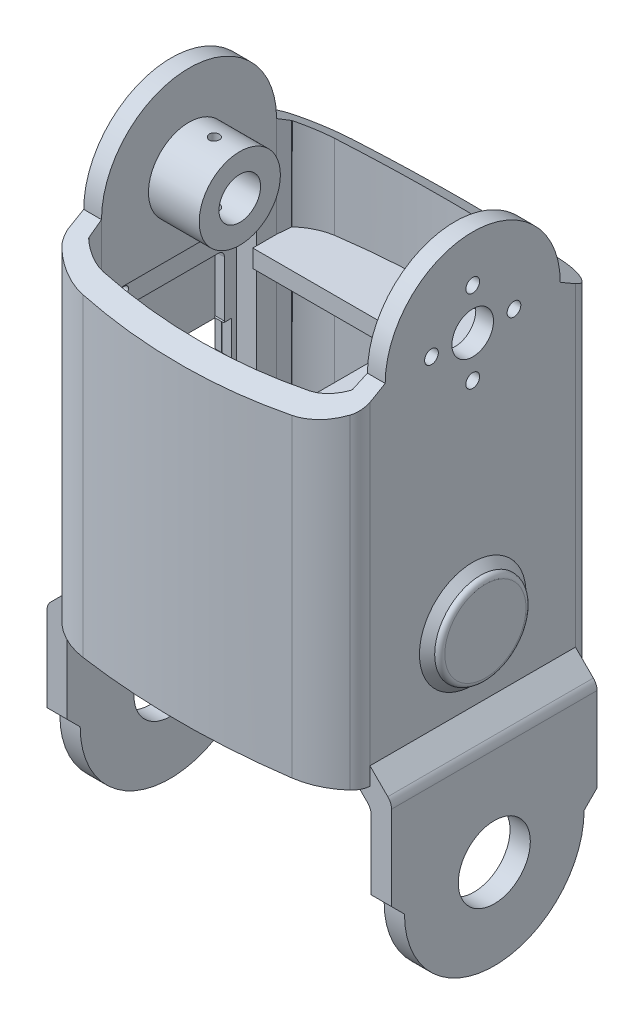
from build123d import *
from build123d.topology import SkipClean

# Parameters (mm, degrees)
SKETCH1_R                = 4.1
SKETCH1_R_2              = 1.35
BOSS_EXTRUDE1_DEPTH      = 3.5
BOSS_EXTRUDE2_DEPTH      = 67.25
CUT_EXTRUDE1_DEPTH       = 94.994268442
SKETCH4_W                = 26.5
SKETCH4_H                = 47.25
CUT_EXTRUDE2_DEPTH       = 3.5
SKETCH6_W                = 31.5
SKETCH6_H                = 52.25
BOSS_EXTRUDE3_DEPTH      = 2
CHAMFER2_SIZE            = 2
SKETCH7_W                = 26.5
SKETCH7_H                = 47.25
CUT_EXTRUDE3_DEPTH       = 0.8
CUT_EXTRUDE4_REACH       = 97.271
SKETCH8_W                = 21.401119101
SKETCH8_H                = 6.5
CUT_EXTRUDE5_REACH       = 97.271
SKETCH9_R                = 7.1
BOSS_EXTRUDE4_DEPTH      = 3.5
SKETCH11_W               = 4
SKETCH11_H               = 49.717369648
BOSS_EXTRUDE5_DEPTH      = 40
SKETCH12_R               = 7.1
CUT_EXTRUDE6_DEPTH       = 10
CHAMFER3_SIZE            = 1
CHAMFER4_SIZE            = 1
FILLET1_R                = 3
SKETCH13_R               = 9
SKETCH13_R_2             = 5.5
BOSS_EXTRUDE6_DEPTH      = 1.5
SKETCH16_R               = 9
BOSS_EXTRUDE7_DEPTH      = 1
FILLET2_R                = 1
SKETCH18_R               = 9
SKETCH18_R_2             = 7.1
BOSS_EXTRUDE8_DEPTH      = 0.5
CHAMFER5_SIZE            = 0.5
BOSS_EXTRUDE9_DEPTH      = 40.5
CUT_EXTRUDE8_REACH       = 129.458
CHAMFER6_SIZE            = 1.5
CUT_EXTRUDE9_REACH       = 129.458
SKETCH20_R               = 7.1
SKETCH21_R               = 1.5
BOSS_EXTRUDE10_DEPTH     = 3.5
CUT_EXTRUDE10_REACH      = 129.458
SKETCH22_R               = 3.75
BOSS_EXTRUDE11_DEPTH     = 1.82
BOSS_EXTRUDE12_START     = 2.65
SKETCH24_W               = 5
SKETCH24_H               = 15.934069979
SKETCH24_R               = 0.8
BOSS_EXTRUDE12_DEPTH     = 2.65
CUT_EXTRUDE11_REACH      = 118.561
SKETCH25_R               = 0.8
SKETCH26_R               = 13.375
CUT_EXTRUDE12_DEPTH      = 3.3
SKETCH27_R               = 5
BOSS_EXTRUDE13_DEPTH     = 1
FILLET7_R                = 0.75
SKETCH28_R               = 8
SKETCH28_R_2             = 4.1
BOSS_EXTRUDE14_DEPTH     = 1.5
SKETCH29_R               = 8
SKETCH29_R_2             = 4.1
BOSS_EXTRUDE15_DEPTH     = 8.5
CUT_EXTRUDE13_DEPTH      = 15
CUT_EXTRUDE13_DEPTH_BACK = 127.447026853
SKETCH30_R               = 1
SKETCH31_R               = 7.1
BOSS_EXTRUDE16_DEPTH     = 0.5
CHAMFER7_SIZE            = 0.5
CHAMFER7_OF_MIRROR5_SIZE = 0.5
FILLET8_R                = 2.5


# Some blends are built 0.0001 mm under size
with BuildPart() as part:
    # Sketch1 → Boss-Extrude1 (new body)
    with BuildSketch(Plane(origin=(0, 0, 0), x_dir=(0, 0, -1), z_dir=(1, 0, 0))):
        with BuildLine():
            Line((-17.25, 0), (-17.25, -67.25))
            Line((-17.25, -67.25), (17.25, -67.25))
            Line((17.25, -67.25), (17.25, 0))
            ThreePointArc((17.25, 0), (0, 17.25), (-17.25, 0))
        make_face()
        Circle(SKETCH1_R, mode=Mode.SUBTRACT)
        with Locations((0, 8.125)):
            Circle(SKETCH1_R_2, mode=Mode.SUBTRACT)
        with Locations((8.125, 0)):
            Circle(SKETCH1_R_2, mode=Mode.SUBTRACT)
        with Locations((-8.125, 0)):
            Circle(SKETCH1_R_2, mode=Mode.SUBTRACT)
        with Locations((0, -8.125)):
            Circle(SKETCH1_R_2, mode=Mode.SUBTRACT)
    boss_extrude1 = extrude(amount=BOSS_EXTRUDE1_DEPTH)

    # Sketch2 → Boss-Extrude2 (add)
    with BuildSketch(Plane(origin=(0, 0, 0), x_dir=(-1, 0, 0), z_dir=(0, -1, 0))):
        with BuildLine():
            Line((-59.4, -17.25), (-59.4, -20.25))
            ThreePointArc((-59.4, -20.25), (-58.989582055, -21.693064324), (-58.079872716, -22.886088403))
            ThreePointArc((-58.079872716, -22.886088403), (-54.454905265, -25.285822393), (-50.289145158, -26.529025904))
            ThreePointArc((-50.289145158, -26.529025904), (-40.020812264, -27.631788405), (-29.7, -28))
            ThreePointArc((-29.7, -28), (-19.379187736, -27.631788405), (-9.110854842, -26.529025904))
            ThreePointArc((-9.110854842, -26.529025904), (-4.945094735, -25.285822393), (-1.320127284, -22.886088403))
            ThreePointArc((-1.320127284, -22.886088403), (-0.410417945, -21.693064324), (0, -20.25))
            Line((0, -20.25), (0, -17.25))
            Line((0, -17.25), (-3.5, -17.25))
            Line((-3.5, -17.25), (-3.735903774, -19.954735321))
            ThreePointArc((-3.735903774, -19.954735321), (-3.770225997, -20.037754997), (-3.828562802, -20.106071165))
            ThreePointArc((-3.828562802, -20.106071165), (-6.407189742, -21.835001354), (-9.364778442, -22.779027613))
            ThreePointArc((-9.364778442, -22.779027613), (-19.505740765, -23.883479028), (-29.7, -24.2522722))
            ThreePointArc((-29.7, -24.2522722), (-39.894259235, -23.883479028), (-50.035221558, -22.779027613))
            ThreePointArc((-50.035221558, -22.779027613), (-52.992810258, -21.835001354), (-55.571437198, -20.106071165))
            ThreePointArc((-55.571437198, -20.106071165), (-55.629774003, -20.037754997), (-55.664096226, -19.954735321))
            Line((-55.664096226, -19.954735321), (-55.9, -17.25))
            Line((-55.9, -17.25), (-59.4, -17.25))
        make_face()
    boss_extrude2 = extrude(amount=BOSS_EXTRUDE2_DEPTH)

    # Mirror2: Boss-Extrude1 across plane
    add(boss_extrude1.mirror(Plane.ZY.offset(-29.7)))

    # Sketch3 → Cut-Extrude1 (cut, through all)
    with BuildSketch(Plane.ZY):
        Polygon((17.25, 0), (32.748612496, -8.948128097), (32.748612496, 0), align=None)
    cut_extrude1 = extrude(amount=-CUT_EXTRUDE1_DEPTH, mode=Mode.SUBTRACT)

    # Mirror3: Boss-Extrude2, Cut-Extrude1 across plane
    add(boss_extrude2.mirror(Plane(origin=(0, 0, 0), x_dir=(1, 0, 0), z_dir=(0, 0, -1))))
    add(cut_extrude1.mirror(Plane(origin=(0, 0, 0), x_dir=(1, 0, 0), z_dir=(0, 0, -1))), mode=Mode.SUBTRACT)

    # Sketch4 → Cut-Extrude2 (cut)
    with BuildSketch(Plane.ZY):
        with Locations((0, -37.125)):
            Rectangle(SKETCH4_W, SKETCH4_H)
    extrude(amount=-CUT_EXTRUDE2_DEPTH, mode=Mode.SUBTRACT)

    # Sketch6 → Boss-Extrude3 (add)
    with BuildSketch(Plane.ZY):
        with Locations((0, -37.125)):
            Rectangle(SKETCH6_W, SKETCH6_H)
    extrude(amount=BOSS_EXTRUDE3_DEPTH)

    # Chamfer2
    chamfer2_edges = [part.edges().sort_by_distance(p)[0] for p in [
        (-2, -63.25, 0),
        (-2, -37.125, 15.75),
        (-2, -37.125, -15.75),
        (-2, -11, 0),
    ]]
    chamfer(chamfer2_edges, length=CHAMFER2_SIZE - 0.0001)  # a hair under: the kernel refuses the full size

    # Sketch7 → Cut-Extrude3 (cut)
    with BuildSketch(Plane(origin=(0, 0, 0), x_dir=(0, 0, -1), z_dir=(1, 0, 0))):
        with Locations((0, -37.125)):
            Rectangle(SKETCH7_W, SKETCH7_H)
    extrude(amount=-CUT_EXTRUDE3_DEPTH, mode=Mode.SUBTRACT)

    # Sketch8 → Cut-Extrude4 (cut, up to next)
    with BuildSketch(Plane.ZY.offset(2), mode=Mode.PRIVATE) as cut_extrude4_sk1:
        with Locations((0.049440449, -35.5)):
            Rectangle(SKETCH8_W, SKETCH8_H)
    cut_extrude4_tool1 = extrude(cut_extrude4_sk1.sketch, amount=-CUT_EXTRUDE4_REACH, mode=Mode.PRIVATE) & part.part
    add(cut_extrude4_tool1.solids().sort_by_distance((-2, -35.5, 0.04944))[0], mode=Mode.SUBTRACT)

    # Sketch9 → Cut-Extrude5 (cut, up to next)
    with BuildSketch(Plane(origin=(59.4, 0, 0), x_dir=(0, 0, -1), z_dir=(1, 0, 0)), mode=Mode.PRIVATE) as cut_extrude5_sk1:
        with Locations((0, -49.64)):
            Circle(SKETCH9_R)
    cut_extrude5_tool1 = extrude(cut_extrude5_sk1.sketch, amount=-CUT_EXTRUDE5_REACH, mode=Mode.PRIVATE) & part.part
    add(cut_extrude5_tool1.solids().sort_by_distance((59.4, -49.64, 0))[0], mode=Mode.SUBTRACT)

    # Sketch10 → Boss-Extrude4 (add)
    with BuildSketch(Plane(origin=(0, -19.75, 0), x_dir=(-1, 0, 0), z_dir=(0, -1, 0))):
        with BuildLine():
            Line((-55.664096226, -19.954735321), (-55.9, -17.25))
            Line((-55.9, -17.25), (-55.9, 17.25))
            Line((-55.9, 17.25), (-55.664096226, 19.954735321))
            ThreePointArc((-55.664096226, 19.954735321), (-55.629774003, 20.037754997), (-55.571437198, 20.106071165))
            ThreePointArc((-55.571437198, 20.106071165), (-52.992810258, 21.835001354), (-50.035221558, 22.779027613))
            ThreePointArc((-50.035221558, 22.779027613), (-29.7, 24.2522722), (-9.364778442, 22.779027613))
            ThreePointArc((-9.364778442, 22.779027613), (-6.407189742, 21.835001354), (-3.828562802, 20.106071165))
            ThreePointArc((-3.828562802, 20.106071165), (-3.770225997, 20.037754997), (-3.735903774, 19.954735321))
            Line((-3.735903774, 19.954735321), (-3.5, 17.25))
            Line((-3.5, 17.25), (-3.5, 12.559999042))
            Line((-3.5, 12.559999042), (-34.519998723, 12.559999042))
            Line((-34.519998723, 12.559999042), (-34.519998723, -12.559999407))
            Line((-34.519998723, -12.559999407), (-3.5, -12.559999407))
            Line((-3.5, -12.559999407), (-3.5, -17.25))
            Line((-3.5, -17.25), (-3.735903774, -19.954735321))
            ThreePointArc((-3.735903774, -19.954735321), (-3.770225997, -20.037754997), (-3.828562802, -20.106071165))
            ThreePointArc((-3.828562802, -20.106071165), (-6.407189742, -21.835001354), (-9.364778442, -22.779027613))
            ThreePointArc((-9.364778442, -22.779027613), (-29.7, -24.2522722), (-50.035221558, -22.779027613))
            ThreePointArc((-50.035221558, -22.779027613), (-52.992810258, -21.835001354), (-55.571437198, -20.106071165))
            ThreePointArc((-55.571437198, -20.106071165), (-55.629774003, -20.037754997), (-55.664096226, -19.954735321))
        make_face()
    extrude(amount=BOSS_EXTRUDE4_DEPTH)

    # Sketch11 → Boss-Extrude5 (add)
    with BuildSketch(Plane(origin=(0, -23.25, 0), x_dir=(-1, 0, 0), z_dir=(0, -1, 0))):
        with Locations((-38.07, 0.750293773)):
            Rectangle(SKETCH11_W, SKETCH11_H)
    extrude(amount=BOSS_EXTRUDE5_DEPTH)

    # Sketch12 → Cut-Extrude6 (cut)
    with BuildSketch(Plane(origin=(40.07, 0, 0), x_dir=(0, 0, -1), z_dir=(1, 0, 0))):
        with Locations((0, -49.64)):
            Circle(SKETCH12_R)
    extrude(amount=-CUT_EXTRUDE6_DEPTH, mode=Mode.SUBTRACT)

    # Chamfer3
    chamfer3_edges = [part.edges().sort_by_distance(p)[0] for p in [
        (36.07, -23.25, 0),
    ]]
    chamfer(chamfer3_edges, length=CHAMFER3_SIZE)

    # Chamfer4
    chamfer4_edges = [part.edges().sort_by_distance(p)[0] for p in [
        (40.07, -23.25, 0),
    ]]
    chamfer(chamfer4_edges, length=CHAMFER4_SIZE)

    # Fillet1
    fillet1_edges = [part.edges().sort_by_distance(p)[0] for p in [
        (38.07084415, -63.25, 24.003715904),
        (38.07084415, -63.25, -24.003715904),
    ]]
    fillet(fillet1_edges, radius=FILLET1_R)

    # Sketch13 → Boss-Extrude6 (add)
    with BuildSketch(Plane(origin=(59.4, 0, 0), x_dir=(0, 0, -1), z_dir=(1, 0, 0))):
        with Locations(Location((0, -49.64, 0), (0, 0, 180))):
            Circle(SKETCH13_R)
        with Locations((0, -49.64)):
            Circle(SKETCH13_R_2, mode=Mode.SUBTRACT)
    extrude(amount=BOSS_EXTRUDE6_DEPTH)

    # Sketch16 → Boss-Extrude7 (add)
    with BuildSketch(Plane(origin=(60.9, 0, 0), x_dir=(0, 0, -1), z_dir=(1, 0, 0))):
        with Locations(Location((0, -49.64, 0), (0, 0, 180))):
            Circle(SKETCH16_R)
    extrude(amount=BOSS_EXTRUDE7_DEPTH)

    # Fillet2
    fillet2_edges = [part.edges().sort_by_distance(p)[0] for p in [
        (61.9, -49.64, -9),
    ]]
    fillet(fillet2_edges, radius=FILLET2_R)

    # Sketch18 → Boss-Extrude8 (add)
    with BuildSketch(Plane.ZY.offset(-55.9)):
        with Locations((0, -49.64)):
            Circle(SKETCH18_R)
        with Locations(Location((0, -49.64, 0), (0, 0, 180))):
            Circle(SKETCH18_R_2, mode=Mode.SUBTRACT)
    extrude(amount=BOSS_EXTRUDE8_DEPTH)

    # Chamfer5
    chamfer5_edges = [part.edges().sort_by_distance(p)[0] for p in [
        (55.9, -49.64, -9),
    ]]
    chamfer(chamfer5_edges, length=CHAMFER5_SIZE - 0.0001)  # a hair under: the kernel refuses the full size

    # Sketch17 → Boss-Extrude9 (add)
    with BuildSketch(Plane(origin=(0, 0, 20.25), x_dir=(-1, 0, 0), z_dir=(0, 0, -1))):
        Polygon((-59.65, -105.91), (-63.15, -105.91), (-63.15, -67.5), (-59.4, -63.75), (-59.4, -67.25), (-55.9, -67.25), (-59.65, -71), align=None)
    boss_extrude9 = extrude(amount=BOSS_EXTRUDE9_DEPTH)

    # Sketch19 → Cut-Extrude8 (cut, up to next)
    with BuildSketch(Plane(origin=(63.15, 0, 0), x_dir=(0, 0, -1), z_dir=(1, 0, 0)), mode=Mode.PRIVATE) as cut_extrude8_sk1:
        with BuildLine():
            ThreePointArc((0, -105.91), (-12.515790027, -100.725790027), (-17.7, -88.21))
            Line((-17.7, -88.21), (-20.25, -85.66))
            Line((-20.25, -85.66), (-20.25, -105.91))
            Line((-20.25, -105.91), (0, -105.91))
        make_face()
    cut_extrude8_tool1 = extrude(cut_extrude8_sk1.sketch, amount=-CUT_EXTRUDE8_REACH, mode=Mode.PRIVATE) & part.part
    # Sketch19 → Cut-Extrude8 (cut, up to next)
    with BuildSketch(Plane(origin=(63.15, 0, 0), x_dir=(0, 0, -1), z_dir=(1, 0, 0)), mode=Mode.PRIVATE) as cut_extrude8_sk2:
        with BuildLine():
            ThreePointArc((17.7, -88.21), (12.515790027, -100.725790027), (0, -105.91))
            Line((0, -105.91), (20.25, -105.91))
            Line((20.25, -105.91), (20.25, -85.66))
            Line((20.25, -85.66), (17.7, -88.21))
        make_face()
    cut_extrude8_tool2 = extrude(cut_extrude8_sk2.sketch, amount=-CUT_EXTRUDE8_REACH, mode=Mode.PRIVATE) & part.part
    cut_extrude8_1 = cut_extrude8_tool1.solids().sort_by_distance((63.15, -99.634492, 15.946502))[0]
    add(cut_extrude8_1, mode=Mode.SUBTRACT)
    cut_extrude8_2 = cut_extrude8_tool2.solids().sort_by_distance((63.15, -99.634492, -15.946502))[0]
    add(cut_extrude8_2, mode=Mode.SUBTRACT)
    cut_extrude8 = cut_extrude8_1 + cut_extrude8_2  # Cut-Extrude8 as one shape, for the pattern or mirror that repeats it

    # Chamfer6
    chamfer6_edges = [part.edges().sort_by_distance(p)[0] for p in [
        (59.4, -49.64, -9),
    ]]
    chamfer(chamfer6_edges, length=CHAMFER6_SIZE - 0.0001)  # a hair under: the kernel refuses the full size

    # Sketch20 → Cut-Extrude9 (cut, up to next)
    with BuildSketch(Plane(origin=(63.15, 0, 0), x_dir=(0, 0, -1), z_dir=(1, 0, 0)), mode=Mode.PRIVATE) as cut_extrude9_sk1:
        with Locations(Location((0, -88.21, 0), (0, 0, 90))):
            Circle(SKETCH20_R)
    cut_extrude9_tool1 = extrude(cut_extrude9_sk1.sketch, amount=-CUT_EXTRUDE9_REACH, mode=Mode.PRIVATE) & part.part
    cut_extrude9 = cut_extrude9_tool1.solids().sort_by_distance((63.15, -88.21, 0))[0]
    add(cut_extrude9, mode=Mode.SUBTRACT)

    # Sketch21 → Boss-Extrude10 (add)
    with BuildSketch(Plane.ZY):
        with Locations((0, 8.125)):
            Circle(SKETCH21_R)
        with Locations((8.125, 0)):
            Circle(SKETCH21_R)
        with Locations((0, -8.125)):
            Circle(SKETCH21_R)
        with Locations((-8.125, 0)):
            Circle(SKETCH21_R)
    extrude(amount=-BOSS_EXTRUDE10_DEPTH)

    # Mirror4: Boss-Extrude9, Cut-Extrude8, Cut-Extrude9 across plane
    add(boss_extrude9.mirror(Plane.ZY.offset(-29.7)))
    add(cut_extrude8.mirror(Plane.ZY.offset(-29.7)), mode=Mode.SUBTRACT)
    add(cut_extrude9.mirror(Plane.ZY.offset(-29.7)), mode=Mode.SUBTRACT)

    # Sketch22 → Cut-Extrude10 (cut, up to next)
    with BuildSketch(Plane.ZY.offset(2), mode=Mode.PRIVATE) as cut_extrude10_sk1:
        with Locations((0, -49.64)):
            Circle(SKETCH22_R)
    cut_extrude10_tool1 = extrude(cut_extrude10_sk1.sketch, amount=-CUT_EXTRUDE10_REACH, mode=Mode.PRIVATE) & part.part
    add(cut_extrude10_tool1.solids().sort_by_distance((-2, -49.64, 0))[0], mode=Mode.SUBTRACT)

    # Sketch23 → Boss-Extrude11 (add)
    with BuildSketch(Plane(origin=(-0.8, 0, 0), x_dir=(0, 0, -1), z_dir=(1, 0, 0))):
        with BuildLine():
            Line((10.8, -38.889999996), (6.999999457, -38.890000068))
            Line((6.999999457, -38.890000068), (6.999996312, -40.653616778))
            ThreePointArc((6.999996312, -40.653616778), (8.489057136, -42.044544733), (9.706479797, -43.678516819))
            Line((9.706479797, -43.678516819), (11.359988862, -43.678515032))
            ThreePointArc((11.359988862, -43.678515032), (11.713588357, -43.532032852), (11.859995379, -43.178403539))
            Line((11.859995379, -43.178403539), (11.86002914, -16.529542904))
            add(Edge.make_bspline(
                [(11.86002914, -16.529542904), (11.860165313, -16.430469267), (11.850209846, -16.333113479), (11.811929636, -16.141528813), (11.783134355, -16.046307589), (11.707972993, -15.864777212), (11.661801756, -15.778752889), (11.553004371, -15.615785201), (11.48982416, -15.538574617), (11.282494862, -15.331229176), (11.115347595, -15.219447642), (10.754781823, -15.069949312), (10.558116563, -15.029804422), (10.360121847, -15.029962825)],
                knots=[0, 0, 0, 0, 0.125, 0.125, 0.25, 0.25, 0.375, 0.375, 0.5, 0.5, 0.75, 0.75, 1, 1, 1, 1], degree=3))
            Line((10.360121847, -15.029962825), (-10.360414785, -15.029965499))
            add(Edge.make_bspline(
                [(-10.360414785, -15.029965499), (-10.459488561, -15.029826786), (-10.556844718, -15.039779883), (-10.748430568, -15.078055492), (-10.843652616, -15.10684852), (-11.025185073, -15.18200551), (-11.111210651, -15.228174695), (-11.274181245, -15.336968247), (-11.351393467, -15.400146655), (-11.558744183, -15.60747118), (-11.670529896, -15.774615995), (-11.820037045, -16.135178663), (-11.86018697, -16.331843248), (-11.860032668, -16.529838302)],
                knots=[0, 0, 0, 0, 0.125, 0.125, 0.25, 0.25, 0.375, 0.375, 0.5, 0.5, 0.75, 0.75, 1, 1, 1, 1], degree=3))
            Line((-11.860032668, -16.529838302), (-11.860001151, -43.178485794))
            ThreePointArc((-11.860001151, -43.178485794), (-11.713562299, -43.532062592), (-11.359992206, -43.678517633))
            Line((-11.359992206, -43.678517633), (-9.706483935, -43.678519702))
            ThreePointArc((-9.706483935, -43.678519702), (-8.489059663, -42.044544533), (-6.999996328, -40.653614235))
            Line((-6.999996328, -40.653614235), (-6.99999946, -38.890000068))
            Line((-6.99999946, -38.890000068), (-10.8, -38.889999996))
            Line((-10.8, -38.889999996), (-10.8, -32.115))
            Line((-10.8, -32.115), (-9.303042913, -32.115))
            Line((-9.303042913, -32.115), (-9.442286694, -31.892101192))
            Line((-9.442286694, -31.892101192), (-9.442286694, -20.936914675))
            ThreePointArc((-9.442286694, -20.936914675), (-9.09081483, -20.088386539), (-8.242286694, -19.736914678))
            Line((-8.242286694, -19.736914678), (8.242286696, -19.736914678))
            ThreePointArc((8.242286696, -19.736914678), (9.090814832, -20.088386541), (9.442286694, -20.936914678))
            Line((9.442286694, -20.936914678), (9.442286694, -31.892101192))
            Line((9.442286694, -31.892101192), (9.303042913, -32.115))
            Line((9.303042913, -32.115), (10.8, -32.115))
            Line((10.8, -32.115), (10.8, -38.889999996))
        make_face()
        with BuildLine():
            ThreePointArc((-10.25, -40.54), (-11.05, -41.340003074), (-10.249993852, -42.14))
            ThreePointArc((-10.249993852, -42.14), (-9.45, -41.339996926), (-10.25, -40.54))
        make_face(mode=Mode.SUBTRACT)
        with BuildLine():
            ThreePointArc((-10.25, -16.09), (-11.05, -16.890003074), (-10.249993852, -17.69))
            ThreePointArc((-10.249993852, -17.69), (-9.45, -16.889996926), (-10.25, -16.09))
        make_face(mode=Mode.SUBTRACT)
        with BuildLine():
            ThreePointArc((10.25, -16.09), (9.45, -16.890003074), (10.250006148, -17.69))
            ThreePointArc((10.250006148, -17.69), (11.05, -16.889996926), (10.25, -16.09))
        make_face(mode=Mode.SUBTRACT)
        with BuildLine():
            ThreePointArc((10.250006759, -42.14), (11.05, -41.339996621), (10.25, -40.54))
            ThreePointArc((10.25, -40.54), (9.45, -41.340003379), (10.250006759, -42.14))
        make_face(mode=Mode.SUBTRACT)
    extrude(amount=BOSS_EXTRUDE11_DEPTH)

    # Sketch24 → Boss-Extrude12 (add)
    # profile 1 of 2: a face of its own
    with BuildSketch(Plane.ZY.offset(-36.07).offset(BOSS_EXTRUDE12_START)):
        with Locations((-10.5, -37.242079847)):
            Rectangle(SKETCH24_W, SKETCH24_H)
        with Locations((-10.25, -41.34)):
            Circle(SKETCH24_R, mode=Mode.SUBTRACT)
    # profile 2 of 2: a face of its own
    with BuildSketch(Plane.ZY.offset(-36.07).offset(BOSS_EXTRUDE12_START)):
        with Locations((10.5, -37.242079847)):
            Rectangle(SKETCH24_W, SKETCH24_H)
        with Locations((10.25, -41.34)):
            Circle(SKETCH24_R, mode=Mode.SUBTRACT)
    extrude(amount=-BOSS_EXTRUDE12_DEPTH)

    # Sketch25 → Cut-Extrude11 (cut, up to next)
    with BuildSketch(Plane.ZY.offset(-36.07), mode=Mode.PRIVATE) as cut_extrude11_sk1:
        with Locations((10.25, -41.34)):
            Circle(SKETCH25_R)
    cut_extrude11_tool1 = extrude(cut_extrude11_sk1.sketch, amount=-CUT_EXTRUDE11_REACH, mode=Mode.PRIVATE) & part.part
    # Sketch25 → Cut-Extrude11 (cut, up to next)
    with BuildSketch(Plane.ZY.offset(-36.07), mode=Mode.PRIVATE) as cut_extrude11_sk2:
        with Locations((-10.25, -41.34)):
            Circle(SKETCH25_R)
    cut_extrude11_tool2 = extrude(cut_extrude11_sk2.sketch, amount=-CUT_EXTRUDE11_REACH, mode=Mode.PRIVATE) & part.part
    add(cut_extrude11_tool1.solids().sort_by_distance((36.07, -41.34, 10.25))[0], mode=Mode.SUBTRACT)
    add(cut_extrude11_tool2.solids().sort_by_distance((36.07, -41.34, -10.25))[0], mode=Mode.SUBTRACT)

    # Sketch26 → Cut-Extrude12 (cut)
    with BuildSketch(Plane.ZY):
        Circle(SKETCH26_R)
    extrude(amount=CUT_EXTRUDE12_DEPTH, mode=Mode.SUBTRACT)

    # Sketch27 → Boss-Extrude13 (add)
    with BuildSketch(Plane.ZY.offset(2)):
        with Locations((0, -49.64)):
            Circle(SKETCH27_R)
    extrude(amount=BOSS_EXTRUDE13_DEPTH)

    # Fillet7
    fillet7_edges = [part.edges().sort_by_distance(p)[0] for p in [
        (-3, -49.64, -5),
    ]]
    fillet(fillet7_edges, radius=FILLET7_R)

    # Sketch28 → Boss-Extrude14 (add)
    with BuildSketch(Plane(origin=(3.5, 0, 0), x_dir=(0, 0, -1), z_dir=(1, 0, 0))):
        Circle(SKETCH28_R)
        Circle(SKETCH28_R_2, mode=Mode.SUBTRACT)
    extrude(amount=BOSS_EXTRUDE14_DEPTH)

    # Sketch29 → Boss-Extrude15 (add)
    with BuildSketch(Plane(origin=(5, 0, 0), x_dir=(0, 0, -1), z_dir=(1, 0, 0))):
        Circle(SKETCH29_R)
        Circle(SKETCH29_R_2, mode=Mode.SUBTRACT)
    extrude(amount=BOSS_EXTRUDE15_DEPTH)

    # Sketch30 → Cut-Extrude13 (cut, two sides: drawn at the far end of the back side and taken through both)
    with BuildSketch(Plane(origin=(0, 0, 0), x_dir=(-1, 0, 0), z_dir=(0, -1, 0)).offset(-CUT_EXTRUDE13_DEPTH_BACK)):
        with Locations(Location((-8.5, 0, 0), (0, 0, 270))):
            Circle(SKETCH30_R)
    extrude(amount=CUT_EXTRUDE13_DEPTH + CUT_EXTRUDE13_DEPTH_BACK, mode=Mode.SUBTRACT)

    # Sketch31 → Boss-Extrude16 (add)
    with SkipClean():  # the faces are left unmerged after this step: merging them gives an invalid solid
        with BuildSketch(Plane.ZY.offset(3.75)):
            with BuildLine():
                Line((-20.25, -67.5), (-20.25, -85.66))
                Line((-20.25, -85.66), (-17.7, -88.21))
                ThreePointArc((-17.7, -88.21), (0, -105.91), (17.7, -88.21))
                Line((17.7, -88.21), (20.25, -85.66))
                Line((20.25, -85.66), (20.25, -67.5))
                Line((20.25, -67.5), (-20.25, -67.5))
            make_face()
            with Locations(Location((0, -88.21, 0), (0, 0, 90))):
                Circle(SKETCH31_R, mode=Mode.SUBTRACT)
        boss_extrude16 = extrude(amount=BOSS_EXTRUDE16_DEPTH)

    # Chamfer7
    chamfer7_edges = [part.edges().sort_by_distance(p)[0] for p in [
        (-4.25, -67.5, 0),
    ]]
    chamfer(chamfer7_edges, length=CHAMFER7_SIZE - 0.0001)  # a hair under: the kernel refuses the full size

    # Mirror5: Boss-Extrude16 across plane
    add(boss_extrude16.mirror(Plane(origin=(29.7, 0, 0), x_dir=(0, 0, 1), z_dir=(1, 0, 0))))

    # Chamfer7 of Mirror5
    chamfer7_of_mirror5_edges = [part.edges().sort_by_distance(p)[0] for p in [
        (63.65, -67.5, 0),
    ]]
    chamfer(chamfer7_of_mirror5_edges, length=CHAMFER7_OF_MIRROR5_SIZE - 0.0001)  # a hair under: the kernel refuses the full size

    # Fillet8
    # the kernel refuses this fillet: 2.5 mm, written as the material it adds along each edge
    with BuildSketch(Plane(origin=(59.65, -71, 20.25), x_dir=(0, -1, 0), z_dir=(0, 0, -1)), Plane(origin=(-0.25, -71, 20.25), x_dir=(0.7071067811865557, 0.7071067811865394, 0), z_dir=(0, 0, -1))) as fillet8_piece_1:
        with BuildLine():
            CenterArc((FILLET8_R * 0.414213562373, FILLET8_R), FILLET8_R, 225, 45)
            Line((-FILLET8_R * 0.292893218813, FILLET8_R * 0.292893218813), (0, 0))
            Line((0, 0), (FILLET8_R * 0.414213562373, 0))
        make_face()
    extrude(amount=40.5)
    # the kernel refuses this fillet: 2.5 mm, written as the material it takes off along each edge
    with BuildSketch(Plane(origin=(-4.25, -67.9999, 22.838834765), x_dir=(0, -1, 0), z_dir=(0, 0, -1))) as fillet8_2_piece_1:
        with BuildLine():
            CenterArc((FILLET8_R * 0.414213562373, -FILLET8_R), FILLET8_R, 90, 45)
            Line((-FILLET8_R * 0.292893218813, -FILLET8_R * 0.292893218813), (0, 0))
            Line((0, 0), (FILLET8_R * 0.414213562373, 0))
        make_face()
    extrude(amount=45.67766953, mode=Mode.SUBTRACT)
    with BuildSketch(Plane(origin=(63.65, -67.9999, 22.838834765), x_dir=(0, -1, 0), z_dir=(0, 0, -1))) as fillet8_2_piece_2:
        with BuildLine():
            CenterArc((FILLET8_R * 0.414213562373, FILLET8_R), FILLET8_R, 225, 45)
            Line((-FILLET8_R * 0.292893218813, FILLET8_R * 0.292893218813), (0, 0))
            Line((0, 0), (FILLET8_R * 0.414213562373, 0))
        make_face()
    extrude(amount=45.67766953, mode=Mode.SUBTRACT)


solid = part.part
